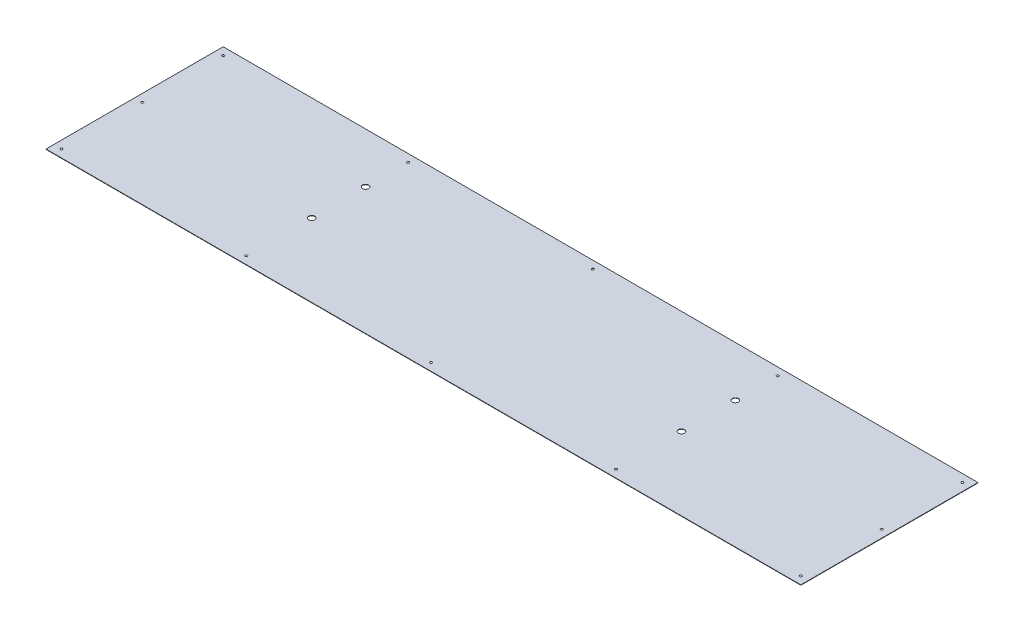
from build123d import *

# Parameters (mm, degrees)
SKETCH1_W           = 1960
SKETCH1_H           = 460
BOSS_EXTRUDE1_DEPTH = 1
SKETCH2_R           = 8
SKETCH2_R_2         = 3
CUT_EXTRUDE1_DEPTH  = 1007.628531286
CHAMFER1_SIZE       = 1


with BuildPart() as part:
    # Sketch1 → Boss-Extrude1 (new body)
    with BuildSketch(Plane(origin=(0, 0, 0), x_dir=(1, 0, 0), z_dir=(0, 1, 0))):
        Rectangle(SKETCH1_W, SKETCH1_H)
    extrude(amount=BOSS_EXTRUDE1_DEPTH)

    # Sketch2 → Cut-Extrude1 (cut, through all)
    with BuildSketch(Plane(origin=(0, 1, 0), x_dir=(1, 0, 0), z_dir=(0, 1, 0))):
        with Locations(Location((480, -40, 0), (0, 0, 270))):
            Circle(SKETCH2_R)
        with Locations(Location((-480, -40, 0), (0, 0, 270))):
            Circle(SKETCH2_R)
        with Locations(Location((-480, 100, 0), (0, 0, 270))):
            Circle(SKETCH2_R)
        with Locations(Location((480, 100, 0), (0, 0, 270))):
            Circle(SKETCH2_R)
        with Locations(Location((960, -210, 0), (0, 0, 270))):
            Circle(SKETCH2_R_2)
        with Locations(Location((-960, -210, 0), (0, 0, 270))):
            Circle(SKETCH2_R_2)
        with Locations(Location((-960, 210, 0), (0, 0, 270))):
            Circle(SKETCH2_R_2)
        with Locations(Location((960, 210, 0), (0, 0, 270))):
            Circle(SKETCH2_R_2)
        with Locations(Location((-960, 0, 0), (0, 0, 270))):
            Circle(SKETCH2_R_2)
        with Locations(Location((960, 0, 0), (0, 0, 270))):
            Circle(SKETCH2_R_2)
        with Locations(Location((0, -210, 0), (0, 0, 270))):
            Circle(SKETCH2_R_2)
        with Locations(Location((0, 210, 0), (0, 0, 270))):
            Circle(SKETCH2_R_2)
        with Locations(Location((480, -210, 0), (0, 0, 270))):
            Circle(SKETCH2_R_2)
        with Locations(Location((-480, -210, 0), (0, 0, 270))):
            Circle(SKETCH2_R_2)
        with Locations(Location((-480, 210, 0), (0, 0, 270))):
            Circle(SKETCH2_R_2)
        with Locations(Location((480, 210, 0), (0, 0, 270))):
            Circle(SKETCH2_R_2)
    extrude(amount=-CUT_EXTRUDE1_DEPTH, mode=Mode.SUBTRACT)

    # Chamfer1
    chamfer1_edges = [part.edges().sort_by_distance(p)[0] for p in [
        (-960, 0, 207),
        (-960, 0, -213),
        (960, 0, -213),
        (-960, 0, -3),
        (960, 0, 207),
        (480, 0, -213),
        (-480, 0, -213),
        (-480, 0, 207),
        (960, 0, -3),
        (0, 0, 207),
        (0, 0, -213),
        (480, 0, 207),
    ]]
    chamfer(chamfer1_edges, length=CHAMFER1_SIZE - 0.0001)  # a hair under: the kernel refuses the full size


solid = part.part
